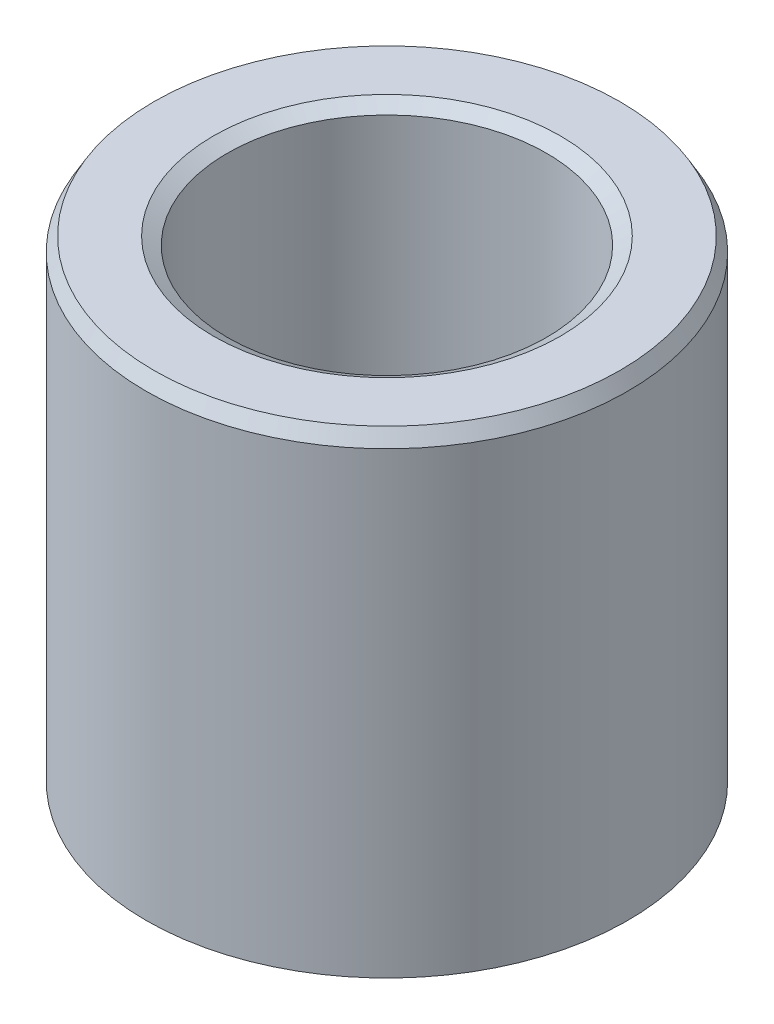
from build123d import *
from OCP.BRepFilletAPI import BRepFilletAPI_MakeChamfer

# Parameters (mm, degrees)
SKETCH1_R           = 55
BOSS_EXTRUDE1_DEPTH = 109.634211936
SKETCH2_R           = 36.436172755
CUT_EXTRUDE1_DEPTH  = 135.423437045
CHAMFER1_SIZE       = 3.17072546
CHAMFER1_SIZE2      = 1.830619198


with BuildPart() as part:
    # Sketch1 → Boss-Extrude1 (new body)
    with BuildSketch(Plane(origin=(0, 0, 0), x_dir=(1, 0, 0), z_dir=(0, 1, 0))):
        Circle(SKETCH1_R)
    extrude(amount=BOSS_EXTRUDE1_DEPTH)

    # Sketch2 → Cut-Extrude1 (cut, through all)
    with BuildSketch(Plane(origin=(0, 0, 0), x_dir=(1, 0, 0), z_dir=(0, 1, 0))):
        Circle(SKETCH2_R)
    extrude(amount=CUT_EXTRUDE1_DEPTH, mode=Mode.SUBTRACT)

    # Chamfer1: one chamfer whose edges measure the first distance from different faces: ONE call of the kernel's chamfer builder (chamfer() names one face for all edges)
    chamfer1_edges_1 = [part.edges().sort_by_distance(p)[0] for p in [
        (-36.436172755, 109.634211936, 0),
    ]]
    chamfer1_side_1 = [part.faces().sort_by_distance(p)[0] for p in [
        (-53.444365081, 109.634211936, 0),
    ]]
    chamfer1_edges_2 = [part.edges().sort_by_distance(p)[0] for p in [
        (-36.436172755, 0, 0),
    ]]
    chamfer1_side_2 = [part.faces().sort_by_distance(p)[0] for p in [
        (-36.436172755, 54.817105968, 0),
    ]]
    chamfer1_edges_3 = [part.edges().sort_by_distance(p)[0] for p in [
        (-55, 0, 0),
    ]]
    chamfer1_side_3 = [part.faces().sort_by_distance(p)[0] for p in [
        (-53.444365081, 0, 0),
    ]]
    chamfer1_edges_4 = [part.edges().sort_by_distance(p)[0] for p in [
        (-55, 109.634211936, 0),
    ]]
    chamfer1_side_4 = [part.faces().sort_by_distance(p)[0] for p in [
        (-55, 54.817105968, 0),
    ]]
    chamfer1 = BRepFilletAPI_MakeChamfer(part.part.solid().wrapped)
    for e in chamfer1_edges_1:
        chamfer1.Add(CHAMFER1_SIZE, CHAMFER1_SIZE2, e.wrapped, chamfer1_side_1[0].wrapped)  # the first distance lies on this face
    for e in chamfer1_edges_2:
        chamfer1.Add(CHAMFER1_SIZE, CHAMFER1_SIZE2, e.wrapped, chamfer1_side_2[0].wrapped)  # the first distance lies on this face
    for e in chamfer1_edges_3:
        chamfer1.Add(CHAMFER1_SIZE, CHAMFER1_SIZE2, e.wrapped, chamfer1_side_3[0].wrapped)  # the first distance lies on this face
    for e in chamfer1_edges_4:
        chamfer1.Add(CHAMFER1_SIZE, CHAMFER1_SIZE2, e.wrapped, chamfer1_side_4[0].wrapped)  # the first distance lies on this face
    add(Compound.cast(chamfer1.Shape()), mode=Mode.REPLACE)


solid = part.part
